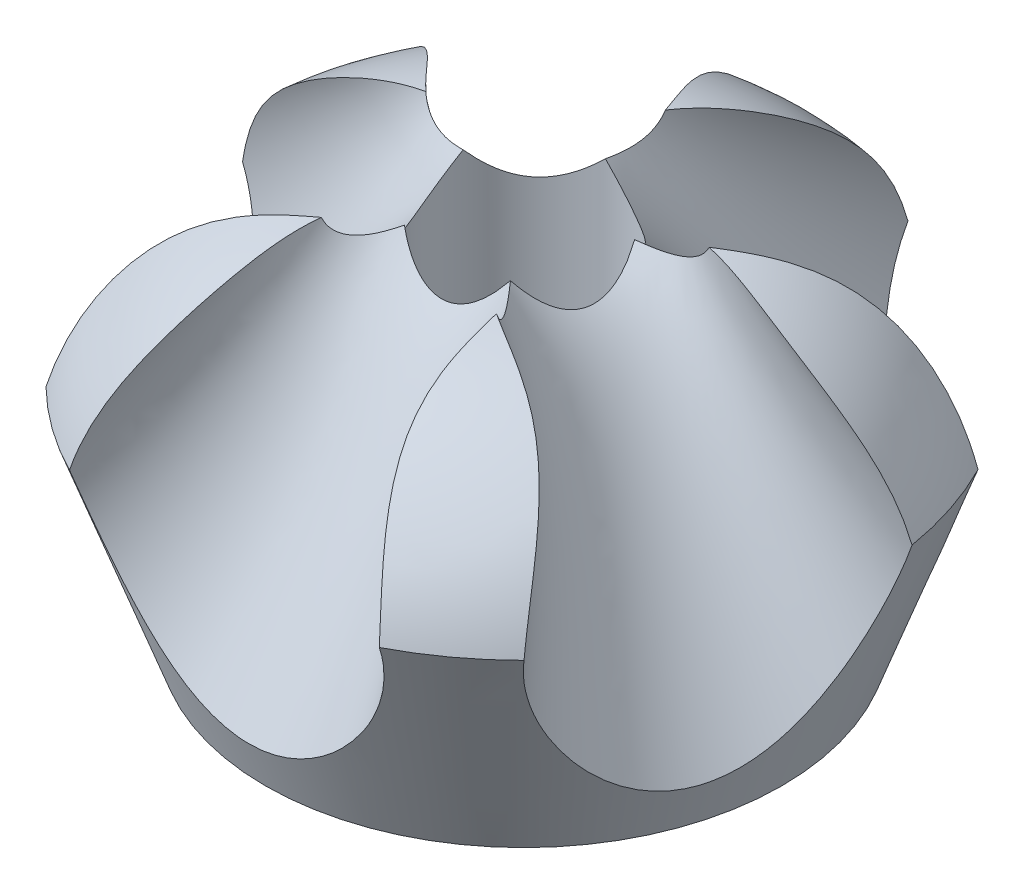
from build123d import *

# Parameters (mm, degrees)
CUT_EXTRUDE1_REACH = 37.568
SKETCH5_R          = 5
CIRPATTERN1_COUNT  = 5


with BuildPart() as part:
    # Sketch1 → Revolve1 (revolve)
    with BuildSketch(Plane.XY, mode=Mode.PRIVATE) as revolve1_sk:
        with BuildLine():
            Line((0, 0), (-15, 0))
            Line((-15, 0), (-19.617271935, 12.685850381))
            ThreePointArc((-19.617271935, 12.685850381), (-11.701817664, 21.377452363), (0, 20.252363623))
            Line((0, 20.252363623), (0, 13))
            Line((0, 13), (0, 0))
        make_face()
    revolve(revolve1_sk.sketch.rotate(Axis((0, 13, 0), (0, -1, 0)), 270), axis=Axis((0, 13, 0), (0, -1, 0)))

    # Sketch5 → Cut-Extrude1 (cut, up to next)
    with BuildSketch(Plane(origin=(0, 0, 0), x_dir=(1, 0, 0), z_dir=(0, 1, 0)), mode=Mode.PRIVATE) as cut_extrude1_sk1:
        with Locations(Location((0, 0, 0), (0, 0, 270))):
            Circle(SKETCH5_R)
    cut_extrude1_tool1 = extrude(cut_extrude1_sk1.sketch, amount=CUT_EXTRUDE1_REACH, mode=Mode.PRIVATE) & part.part
    add(cut_extrude1_tool1.solids().sort_by_distance((0, 0, 0))[0], mode=Mode.SUBTRACT)

    # Cut-Loft1: read off the stored shape, not the designer's step
    # Cut-Loft1: loft between two sections, ruled curve by curve
    cut_loft1_from = [
        Edge.make_bspline([(-6.436058749, 29.57153688, 0), (-6.435472385, 29.26776658, 0), (-6.413144179, 28.982430705, 0), (-6.340915671, 28.451011544, 0), (-6.28627718, 28.170067162, 0), (-6.125253569, 27.584252896, 0), (-6.01886845, 27.279383013, 0), (-5.739653433, 26.652261846, 0), (-5.566497089, 26.330680636, 0), (-5.138209705, 25.689200079, 0), (-4.882886126, 25.369290167, 0), (-4.280271242, 24.758413009, 0), (-3.932750004, 24.467575785, 0), (-3.1474314, 23.950302258, 0), (-2.709490254, 23.724180364, 0), (-1.762875392, 23.373406588, 0), (-1.254306815, 23.249167019, 0), (-0.205007858, 23.129428379, 0), (0.335322934, 23.134204786, 0), (1.398161254, 23.278661801, 0), (1.920165665, 23.418274028, 0), (2.899441434, 23.81372897, 0), (3.356401226, 24.069199549, 0), (4.175054164, 24.659901932, 0), (4.536756032, 24.994708319, 0), (5.155524833, 25.702820163, 0), (5.412814244, 26.075860992, 0), (5.830524148, 26.825416885, 0), (5.991200935, 27.201868014, 0), (6.232739192, 27.93438877, 0), (6.313783396, 28.290519969, 0), (6.415489633, 28.96941453, 0), (6.436645112, 29.291619256, 0), (6.435472385, 29.899159857, 0), (6.413144179, 30.184495732, 0), (6.340915671, 30.715914893, 0), (6.28627718, 30.996859275, 0), (6.125253569, 31.58267354, 0), (6.01886845, 31.887543424, 0), (5.739653433, 32.514664591, 0), (5.566497089, 32.836245801, 0), (5.138209705, 33.477726357, 0), (4.882886126, 33.79763627, 0), (4.280271242, 34.408513427, 0), (3.932750004, 34.699350652, 0), (3.1474314, 35.216624179, 0), (2.709490254, 35.442746073, 0), (1.762875392, 35.793519849, 0), (1.254306815, 35.917759418, 0), (0.205007858, 36.037498058, 0), (-0.335322934, 36.032721651, 0), (-1.398161254, 35.888264636, 0), (-1.920165665, 35.748652409, 0), (-2.899441434, 35.353197467, 0), (-3.356401226, 35.097726888, 0), (-4.175054164, 34.507024504, 0), (-4.536756032, 34.172218118, 0), (-5.155524833, 33.464106274, 0), (-5.412814244, 33.091065445, 0), (-5.830524148, 32.341509552, 0), (-5.991200935, 31.965058423, 0), (-6.232739192, 31.232537667, 0), (-6.313783396, 30.876406468, 0), (-6.415489633, 30.197511906, 0), (-6.436645112, 29.875307181, 0), (-6.436058749, 29.57153688, 0)], [0.46875, 0.46875, 0.46875, 0.46875, 0.5, 0.5, 0.53125, 0.53125, 0.5625, 0.5625, 0.59375, 0.59375, 0.625, 0.625, 0.65625, 0.65625, 0.6875, 0.6875, 0.71875, 0.71875, 0.75, 0.75, 0.78125, 0.78125, 0.8125, 0.8125, 0.84375, 0.84375, 0.875, 0.875, 0.90625, 0.90625, 0.9375, 0.9375, 0.96875, 0.96875, 1, 1, 1.03125, 1.03125, 1.0625, 1.0625, 1.09375, 1.09375, 1.125, 1.125, 1.15625, 1.15625, 1.1875, 1.1875, 1.21875, 1.21875, 1.25, 1.25, 1.28125, 1.28125, 1.3125, 1.3125, 1.34375, 1.34375, 1.375, 1.375, 1.40625, 1.40625, 1.4375, 1.4375, 1.46875, 1.46875, 1.46875, 1.46875], 3),
    ]
    cut_loft1_to = [
        Edge.make_bspline([(1.312124686, 21.074988591, 22.670668535), (0.849720077, 21.133182993, 22.691849565), (0.41186136, 21.157188184, 22.70058674), (-0.41186136, 21.157188184, 22.70058674), (-0.849720077, 21.133182993, 22.691849565), (-1.774529295, 21.01679419, 22.649487505), (-2.261613099, 20.924355098, 22.615842427), (-3.273803577, 20.646936954, 22.51487048), (-3.799045372, 20.461807237, 22.447488773), (-4.863926151, 19.973985189, 22.269936069), (-5.40362104, 19.671019554, 22.159665595), (-6.457986121, 18.92793524, 21.889205023), (-6.972505992, 18.487462449, 21.728886038), (-7.922206197, 17.464890676, 21.356700351), (-8.356937764, 16.882524955, 21.144736563), (-9.08660218, 15.596911954, 20.676811698), (-9.380885769, 14.893734892, 20.420876178), (-9.780171954, 13.41636016, 19.88315575), (-9.884672635, 12.642680411, 19.601559351), (-9.884672635, 11.094588089, 19.038099826), (-9.780171954, 10.32090834, 18.756503426), (-9.380885769, 8.843533608, 18.218782999), (-9.08660218, 8.140356546, 17.962847479), (-8.356937764, 6.854743545, 17.494922614), (-7.922206197, 6.272377824, 17.282958826), (-6.972505992, 5.249806051, 16.910773138), (-6.457986121, 4.80933326, 16.750454153), (-5.40362104, 4.066248946, 16.479993581), (-4.863926151, 3.763283311, 16.369723108), (-3.799045372, 3.275461263, 16.192170403), (-3.273803577, 3.090331546, 16.124788697), (-2.261613099, 2.812913402, 16.02381675), (-1.774529295, 2.72047431, 15.990171672), (-0.849720077, 2.604085507, 15.947809612), (-0.41186136, 2.580080316, 15.939072437), (0.41186136, 2.580080316, 15.939072437), (0.849720077, 2.604085507, 15.947809612), (1.774529295, 2.72047431, 15.990171672), (2.261613099, 2.812913402, 16.02381675), (3.273803577, 3.090331546, 16.124788697), (3.799045372, 3.275461263, 16.192170403), (4.863926151, 3.763283311, 16.369723108), (5.40362104, 4.066248946, 16.479993581), (6.457986121, 4.80933326, 16.750454153), (6.972505992, 5.249806051, 16.910773138), (7.922206197, 6.272377824, 17.282958826), (8.356937764, 6.854743545, 17.494922614), (9.08660218, 8.140356546, 17.962847479), (9.380885769, 8.843533608, 18.218782999), (9.780171954, 10.32090834, 18.756503426), (9.884672635, 11.094588089, 19.038099826), (9.884672635, 12.642680411, 19.601559351), (9.780171954, 13.41636016, 19.88315575), (9.380885769, 14.893734892, 20.420876178), (9.08660218, 15.596911954, 20.676811698), (8.356937764, 16.882524955, 21.144736563), (7.922206197, 17.464890676, 21.356700351), (6.972505992, 18.487462449, 21.728886038), (6.457986121, 18.92793524, 21.889205023), (5.40362104, 19.671019554, 22.159665595), (4.863926151, 19.973985189, 22.269936069), (3.799045372, 20.461807237, 22.447488773), (3.273803577, 20.646936954, 22.51487048), (2.261613099, 20.924355098, 22.615842427), (1.774529295, 21.01679419, 22.649487505), (1.312124686, 21.074988591, 22.670668535)], [0.46875, 0.46875, 0.46875, 0.46875, 0.5, 0.5, 0.53125, 0.53125, 0.5625, 0.5625, 0.59375, 0.59375, 0.625, 0.625, 0.65625, 0.65625, 0.6875, 0.6875, 0.71875, 0.71875, 0.75, 0.75, 0.78125, 0.78125, 0.8125, 0.8125, 0.84375, 0.84375, 0.875, 0.875, 0.90625, 0.90625, 0.9375, 0.9375, 0.96875, 0.96875, 1, 1, 1.03125, 1.03125, 1.0625, 1.0625, 1.09375, 1.09375, 1.125, 1.125, 1.15625, 1.15625, 1.1875, 1.1875, 1.21875, 1.21875, 1.25, 1.25, 1.28125, 1.28125, 1.3125, 1.3125, 1.34375, 1.34375, 1.375, 1.375, 1.40625, 1.40625, 1.4375, 1.4375, 1.46875, 1.46875, 1.46875, 1.46875], 3),
    ]
    cut_loft1 = Solid(Shell([*[Face.make_surface_from_curves(cut_loft1_from[k], cut_loft1_to[k]) for k in range(1)], Face(Wire(cut_loft1_from)), Face(Wire(cut_loft1_to))]))
    add(cut_loft1, mode=Mode.SUBTRACT)

    # CirPattern1: Cut-Loft1 ×5 about axis
    cirpattern1_axis = Axis((0, 12.685850381, 0), (0, 1, 0))
    for i in range(1, CIRPATTERN1_COUNT):
        add(cut_loft1.rotate(cirpattern1_axis, i * 360 / CIRPATTERN1_COUNT), mode=Mode.SUBTRACT)


solid = part.part
